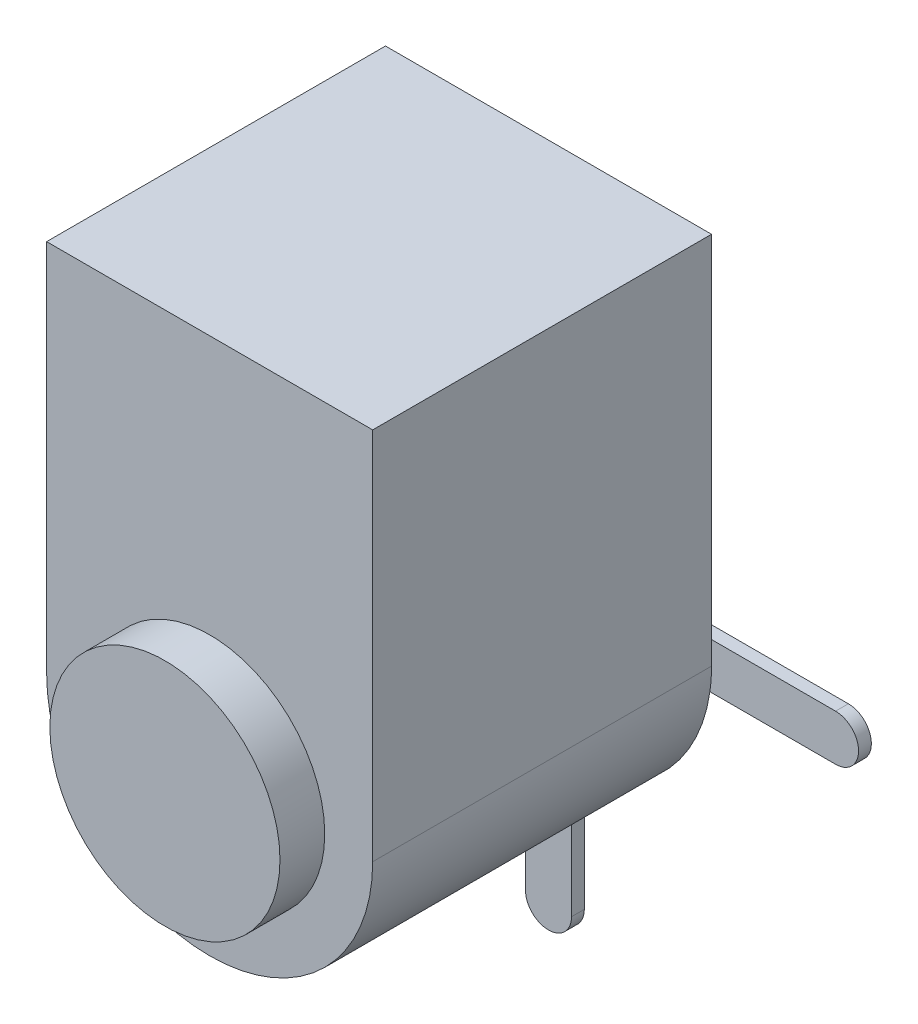
from build123d import *

# Parameters (mm, degrees)
SKETCH2_R           = 18
BOSS_EXTRUDE1_DEPTH = 60
BOSS_EXTRUDE2_DEPTH = 53
BOSS_EXTRUDE3_DEPTH = 2


with BuildPart() as part:
    # Sketch2 → Boss-Extrude1 (new body)
    with BuildSketch(Plane.XY):
        Circle(SKETCH2_R)
    extrude(amount=BOSS_EXTRUDE1_DEPTH)

    # Sketch3 → Boss-Extrude2 (add)
    with BuildSketch(Plane.XY):
        with BuildLine():
            Line((-25.5, 0), (-25.5, 58.5))
            Line((-25.5, 58.5), (25.5, 58.5))
            Line((25.5, 58.5), (25.5, 0))
            ThreePointArc((25.5, 0), (0, -25.5), (-25.5, 0))
        make_face()
    extrude(amount=BOSS_EXTRUDE2_DEPTH)

    # Sketch4 → Boss-Extrude3 (add)
    with BuildSketch(Plane.XY):
        with BuildLine():
            Line((-3.6, 19.027416998), (-19.027416998, 3.6))
            Line((-19.027416998, 3.6), (-44.9, 3.6))
            ThreePointArc((-44.9, 3.6), (-48.5, 0), (-44.9, -3.6))
            Line((-44.9, -3.6), (-19.027416998, -3.6))
            Line((-19.027416998, -3.6), (-3.6, -19.027416998))
            Line((-3.6, -19.027416998), (-3.6, -44.9))
            ThreePointArc((-3.6, -44.9), (0, -48.5), (3.6, -44.9))
            Line((3.6, -44.9), (3.6, -19.027416998))
            Line((3.6, -19.027416998), (19.027416998, -3.6))
            Line((19.027416998, -3.6), (44.9, -3.6))
            ThreePointArc((44.9, -3.6), (48.5, 0), (44.9, 3.6))
            Line((44.9, 3.6), (19.027416998, 3.6))
            Line((19.027416998, 3.6), (3.6, 19.027416998))
            Line((3.6, 19.027416998), (3.6, 44.9))
            ThreePointArc((3.6, 44.9), (0, 48.5), (-3.6, 44.9))
            Line((-3.6, 44.9), (-3.6, 19.027416998))
        make_face()
    extrude(amount=-BOSS_EXTRUDE3_DEPTH)


solid = part.part
